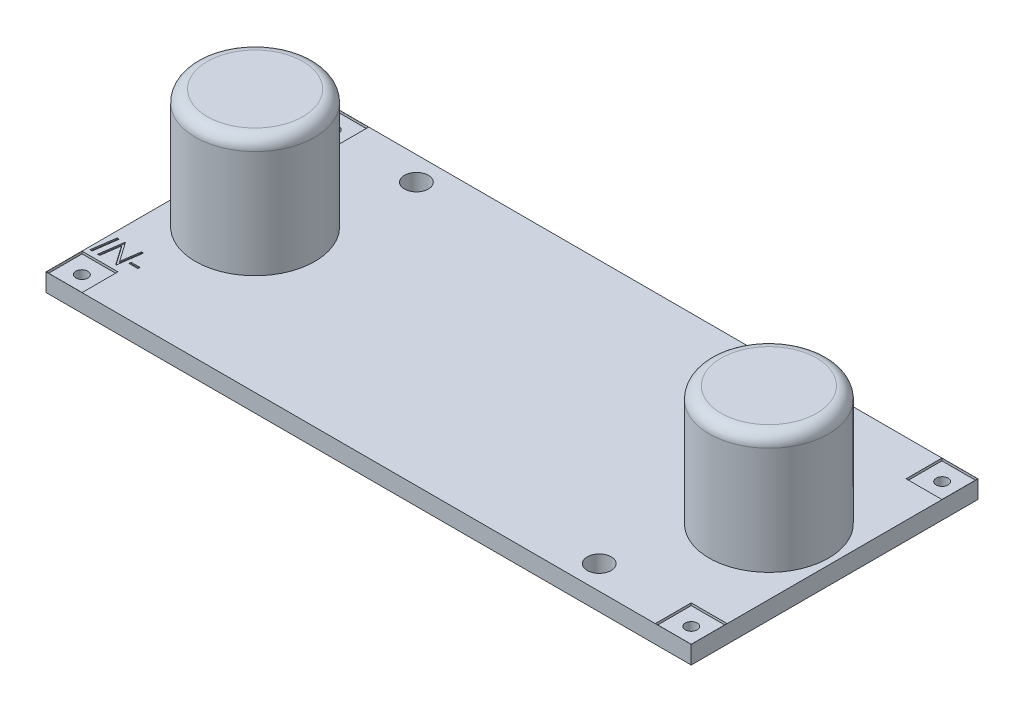
from build123d import *

# Parameters (mm, degrees)
SKETCH1_W           = 54
SKETCH1_H           = 24
BOSS_EXTRUDE1_DEPTH = 1.5
CUT_EXTRUDE1_REACH  = 61.112
SKETCH2_R           = 1
SKETCH4_W           = 3
SKETCH4_H           = 3
CUT_EXTRUDE2_DEPTH  = 0.2
CUT_EXTRUDE3_REACH  = 61.112
SKETCH5_R           = 0.5
CUT_EXTRUDE4_DEPTH  = 0.1
CUT_EXTRUDE5_DEPTH  = 0.1
SKETCH10_R          = 5
BOSS_EXTRUDE2_DEPTH = 10
FILLET1_R           = 1


with BuildPart() as part:
    # Sketch1 → Boss-Extrude1 (new body)
    with BuildSketch(Plane(origin=(0, 0, 0), x_dir=(1, 0, 0), z_dir=(0, 1, 0))):
        with Locations((27, -12)):
            Rectangle(SKETCH1_W, SKETCH1_H)
    extrude(amount=BOSS_EXTRUDE1_DEPTH)

    # Sketch2 → Cut-Extrude1 (cut, up to next)
    with BuildSketch(Plane(origin=(0, 1.5, 0), x_dir=(1, 0, 0), z_dir=(0, 1, 0)), mode=Mode.PRIVATE) as cut_extrude1_sk1:
        with Locations((9, -2)):
            Circle(SKETCH2_R)
    cut_extrude1_tool1 = extrude(cut_extrude1_sk1.sketch, amount=-CUT_EXTRUDE1_REACH, mode=Mode.PRIVATE) & part.part
    # Sketch2 → Cut-Extrude1 (cut, up to next)
    with BuildSketch(Plane(origin=(0, 1.5, 0), x_dir=(1, 0, 0), z_dir=(0, 1, 0)), mode=Mode.PRIVATE) as cut_extrude1_sk2:
        with Locations((44.3, -22)):
            Circle(SKETCH2_R)
    cut_extrude1_tool2 = extrude(cut_extrude1_sk2.sketch, amount=-CUT_EXTRUDE1_REACH, mode=Mode.PRIVATE) & part.part
    add(cut_extrude1_tool1.solids().sort_by_distance((9, 1.5, 2))[0], mode=Mode.SUBTRACT)
    add(cut_extrude1_tool2.solids().sort_by_distance((44.3, 1.5, 22))[0], mode=Mode.SUBTRACT)

    # Sketch4 → Cut-Extrude2 (cut)
    with BuildSketch(Plane(origin=(0, 1.5, 0), x_dir=(1, 0, 0), z_dir=(0, 1, 0))):
        with Locations((1.51, -1.51)):
            Rectangle(SKETCH4_W, SKETCH4_H)
        with Locations((52.49, -1.51)):
            Rectangle(SKETCH4_W, SKETCH4_H)
        with Locations((1.51, -22.49)):
            Rectangle(SKETCH4_W, SKETCH4_H)
        with Locations((52.49, -22.49)):
            Rectangle(SKETCH4_W, SKETCH4_H)
    extrude(amount=-CUT_EXTRUDE2_DEPTH, mode=Mode.SUBTRACT)

    # Sketch5 → Cut-Extrude3 (cut, up to next)
    with BuildSketch(Plane.XZ, mode=Mode.PRIVATE) as cut_extrude3_sk1:
        with Locations((52.5, 1.5)):
            Circle(SKETCH5_R)
    cut_extrude3_tool1 = extrude(cut_extrude3_sk1.sketch, amount=-CUT_EXTRUDE3_REACH, mode=Mode.PRIVATE) & part.part
    # Sketch5 → Cut-Extrude3 (cut, up to next)
    with BuildSketch(Plane.XZ, mode=Mode.PRIVATE) as cut_extrude3_sk2:
        with Locations((52.5, 22.5)):
            Circle(SKETCH5_R)
    cut_extrude3_tool2 = extrude(cut_extrude3_sk2.sketch, amount=-CUT_EXTRUDE3_REACH, mode=Mode.PRIVATE) & part.part
    # Sketch5 → Cut-Extrude3 (cut, up to next)
    with BuildSketch(Plane.XZ, mode=Mode.PRIVATE) as cut_extrude3_sk3:
        with Locations((1.5, 1.5)):
            Circle(SKETCH5_R)
    cut_extrude3_tool3 = extrude(cut_extrude3_sk3.sketch, amount=-CUT_EXTRUDE3_REACH, mode=Mode.PRIVATE) & part.part
    # Sketch5 → Cut-Extrude3 (cut, up to next)
    with BuildSketch(Plane.XZ, mode=Mode.PRIVATE) as cut_extrude3_sk4:
        with Locations((1.5, 22.5)):
            Circle(SKETCH5_R)
    cut_extrude3_tool4 = extrude(cut_extrude3_sk4.sketch, amount=-CUT_EXTRUDE3_REACH, mode=Mode.PRIVATE) & part.part
    add(cut_extrude3_tool1.solids().sort_by_distance((52.5, 0, 1.5))[0], mode=Mode.SUBTRACT)
    add(cut_extrude3_tool2.solids().sort_by_distance((52.5, 0, 22.5))[0], mode=Mode.SUBTRACT)
    add(cut_extrude3_tool3.solids().sort_by_distance((1.5, 0, 1.5))[0], mode=Mode.SUBTRACT)
    add(cut_extrude3_tool4.solids().sort_by_distance((1.5, 0, 22.5))[0], mode=Mode.SUBTRACT)

    # Sketch8 → Cut-Extrude4 (cut)
    with BuildSketch(Plane(origin=(0, 1.5, 0), x_dir=(1, 0, 0), z_dir=(0, 1, 0))):
        Polygon((0.556961838, -3.555375385), (0.73765094, -3.555375385), (0.457202222, -5.555375385), (0.27651312, -5.555375385), align=None)
        Polygon((2.58140094, -3.555375385), (2.762090043, -3.555375385), (2.481641325, -5.555375385), (2.438372094, -5.555375385), (1.321384915, -3.96362859), (1.098227863, -5.555375385), (0.917538761, -5.555375385), (1.197987479, -3.555375385), (1.24125671, -3.555375385), (2.357843248, -5.146721539), align=None)
        Polygon((3.635487479, -4.478452308), (3.635487479, -3.888708718), (3.814974658, -3.888708718), (3.814974658, -4.478452308), (4.404718248, -4.478452308), (4.404718248, -4.657939488), (3.814974658, -4.657939488), (3.814974658, -5.247683077), (3.635487479, -5.247683077), (3.635487479, -4.657939488), (3.045743889, -4.657939488), (3.045743889, -4.478452308), align=None)
    extrude(amount=-CUT_EXTRUDE4_DEPTH, mode=Mode.SUBTRACT)

    # Sketch9 → Cut-Extrude5 (cut)
    with BuildSketch(Plane(origin=(0, 1.5, 0), x_dir=(1, 0, 0), z_dir=(0, 1, 0))):
        Polygon((0.519157464, -18.562132586), (0.699846567, -18.562132586), (0.419397849, -20.562132586), (0.238708746, -20.562132586), align=None)
        Polygon((2.543596567, -18.562132586), (2.724285669, -18.562132586), (2.443836951, -20.562132586), (2.40056772, -20.562132586), (1.283580541, -18.970385792), (1.06042349, -20.562132586), (0.879734387, -20.562132586), (1.160183105, -18.562132586), (1.203452336, -18.562132586), (2.320038874, -20.15347874), align=None)
        Polygon((2.8769299, -19.741619766), (3.623324131, -19.741619766), (3.598885028, -19.921106945), (2.854093361, -19.921106945), align=None)
    extrude(amount=-CUT_EXTRUDE5_DEPTH, mode=Mode.SUBTRACT)

    # Sketch10 → Boss-Extrude2 (add)
    with BuildSketch(Plane(origin=(0, 1.5, 0), x_dir=(1, 0, 0), z_dir=(0, 1, 0))):
        with Locations((5.5, -12)):
            Circle(SKETCH10_R)
        with Locations((48.5, -12)):
            Circle(SKETCH10_R)
    extrude(amount=BOSS_EXTRUDE2_DEPTH)

    # Fillet1
    fillet1_edges = [part.edges().sort_by_distance(p)[0] for p in [
        (0.5, 11.5, 12),
        (43.5, 11.5, 12),
    ]]
    fillet(fillet1_edges, radius=FILLET1_R)


solid = part.part
